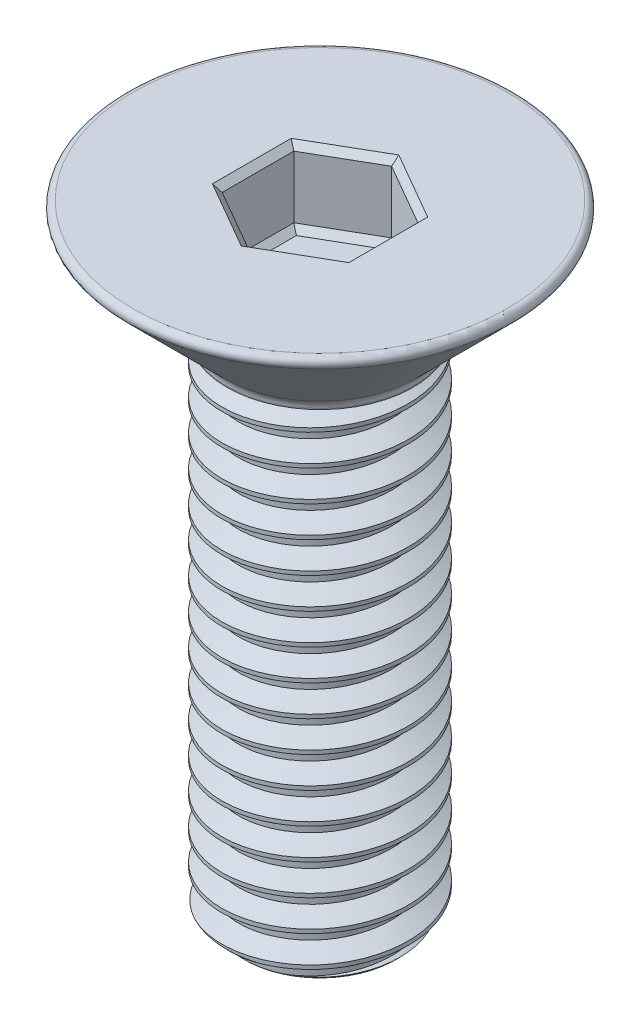
from build123d import *

# Parameters (mm, degrees)
SKETCH1_R           = 1.5
BOSS_EXTRUDE1_DEPTH = 8.14
THREAD1_PITCH       = 0.5
SKETCH5_R           = 1.5
BOSS_EXTRUDE2_DEPTH = 0.1
SKETCH6_R           = 1.5
BOSS_EXTRUDE3_DEPTH = 1.76
BOSS_EXTRUDE3_DRAFT = -45
FILLET1_R           = 0.1
FILLET2_R           = 0.2
CUT_EXTRUDE1_DEPTH  = 1.1
CHAMFER1_SIZE       = 0.1
CUT_EXTRUDE2_DEPTH  = 0.1
CUT_EXTRUDE2_DRAFT  = -45


with BuildPart() as part:
    # Sketch1 → Boss-Extrude1 (new body)
    with BuildSketch(Plane(origin=(0, 0, 0), x_dir=(1, 0, 0), z_dir=(0, 1, 0))):
        with Locations(Location((0, 0, 0), (0, 0, 270))):
            Circle(SKETCH1_R)
    extrude(amount=BOSS_EXTRUDE1_DEPTH)

    # Thread1: the profile of Thread Profile1 profile screwed along a right-hand helix of 18.28 turns, 6 arcs to a turn; built about Z, then put on its axis
    thread1_z = Axis((0, 0, 0), (0, 0, 1))
    thread1_corners = [(1.5003, 0, -0.000173205), (1.5003, 0, 0.437673204), (1.229367063, 0, 0.281249999), (1.229367063, 0, 0.156249999)]
    with BuildLine(mode=Mode.PRIVATE) as thread1_profile:
        Line(thread1_corners[0], thread1_corners[1])
        Line(thread1_corners[1], thread1_corners[2])
        Line(thread1_corners[2], thread1_corners[3])
        Line(thread1_corners[3], thread1_corners[0])
    thread1_cap = Face(thread1_profile.wire())
    thread1_turn_angles = [0, 30, 60, 90, 120, 150, 180, 210, 240, 270, 300, 330, 360]
    thread1_turn_weights = [1, 0.8660254037844387, 1, 0.8660254037844387, 1, 0.8660254037844387, 1, 0.8660254037844387, 1, 0.8660254037844387, 1, 0.8660254037844387, 1]
    thread1_turn_rails = [Edge.make_bspline([Vector(p[0], p[1], 0).rotate(thread1_z, thread1_turn_angles[k]) / thread1_turn_weights[k] + Vector(0, 0, p[2] + THREAD1_PITCH * thread1_turn_angles[k] / 360) for k in range(13)], [0, 0, 0, 1, 1, 2, 2, 3, 3, 4, 4, 5, 5, 6, 6, 6], 2, thread1_turn_weights) for p in thread1_corners]
    thread1_turn_sides = [Face.make_surface_from_curves(thread1_turn_rails[p[0]], thread1_turn_rails[p[1]]) for p in [(0, 1), (1, 2), (2, 3), (3, 0)]]
    thread1_last_angles = [6480, 6510, 6540, 6560.4, 6580.8]
    thread1_last_weights = [1, 0.8660254037844387, 1, 0.9372819894918855, 1]
    thread1_last_rails = [Edge.make_bspline([Vector(p[0], p[1], 0).rotate(thread1_z, thread1_last_angles[k]) / thread1_last_weights[k] + Vector(0, 0, p[2] + THREAD1_PITCH * thread1_last_angles[k] / 360) for k in range(5)], [0, 0, 0, 1, 1, 2, 2, 2], 2, thread1_last_weights) for p in thread1_corners]
    thread1_last_sides = [Face.make_surface_from_curves(thread1_last_rails[p[0]], thread1_last_rails[p[1]]) for p in [(0, 1), (1, 2), (2, 3), (3, 0)]]
    thread1 = Plane(origin=(0, 9.14, 0), x_dir=(-1, 0, 0), z_dir=(0, -1, 0)) * Solid(Shell([*[p.moved(Location((0, 0, THREAD1_PITCH * i))) for i in range(18) for p in thread1_turn_sides], *thread1_last_sides, thread1_cap, thread1_cap.rotate(thread1_z, 6580.8).moved(Location((0, 0, THREAD1_PITCH * 6580.8 / 360)))]))
    add(thread1, mode=Mode.SUBTRACT)

    # Sketch5 → Boss-Extrude2 (add)
    with BuildSketch(Plane(origin=(0, 8.14, 0), x_dir=(1, 0, 0), z_dir=(0, 1, 0))):
        with Locations(Location((0, 0, 0), (0, 0, 79.630240194))):
            Circle(SKETCH5_R)
    extrude(amount=BOSS_EXTRUDE2_DEPTH)


with BuildPart() as boss_extrude3_tool:
    # Sketch6 → Boss-Extrude3 (with draft: the straight prism first)
    with BuildSketch(Plane(origin=(0, 8.24, 0), x_dir=(1, 0, 0), z_dir=(0, 1, 0))):
        with Locations(Location((0, 0, 0), (0, 0, 79.630240194))):
            Circle(SKETCH6_R)
    extrude(amount=BOSS_EXTRUDE3_DEPTH)
    # Boss-Extrude3: the draft: its side faces are tilted about the plane it starts from
    boss_extrude3_sides = [boss_extrude3_tool.faces().sort_by_distance(p)[0] for p in [
        (-0.27, 9.12, 1.475499915),
    ]]
    draft(boss_extrude3_sides, Plane(origin=(0, 8.24, 0), x_dir=(1, 0, 0), z_dir=(0, 1, 0)), BOSS_EXTRUDE3_DRAFT)


with BuildPart() as part_1:
    add(part.part)

    # Boss-Extrude3: add boss_extrude3_tool
    add(boss_extrude3_tool.part)

    # Sketch7 → Cut-Revolve1 (revolve, cut)
    with BuildSketch(Plane.XY, mode=Mode.PRIVATE) as cut_revolve1_sk:
        Polygon((1.51, 0), (1.51, 0.3), (1.21, 0), align=None)
    revolve(cut_revolve1_sk.sketch.rotate(Axis((0, 0, 0), (0, 1, 0)), 135.522486844), axis=Axis((0, 0, 0), (0, 1, 0)), mode=Mode.SUBTRACT)

    # Fillet1
    fillet1_edges = [part_1.edges().sort_by_distance(p)[0] for p in [
        (-0.5868, 10, 3.206753149),
    ]]
    fillet(fillet1_edges, radius=FILLET1_R)

    # Fillet2
    fillet2_edges = [part_1.edges().sort_by_distance(p)[0] for p in [
        (-0.27, 8.24, 1.475499915),
    ]]
    fillet(fillet2_edges, radius=FILLET2_R)

    # Sketch8 → Cut-Extrude1 (cut)
    with BuildSketch(Plane(origin=(0, 10, 0), x_dir=(1, 0, 0), z_dir=(0, 1, 0))):
        Polygon((0, 1.154700538), (-1, 0.577350269), (-1, -0.577350269), (0, -1.154700538), (1, -0.577350269), (1, 0.577350269), align=None)
    extrude(amount=-CUT_EXTRUDE1_DEPTH, mode=Mode.SUBTRACT)

    # Chamfer1
    chamfer1_edges = [part_1.edges().sort_by_distance(p)[0] for p in [
        (0.5, 10, -0.866025404),
        (-0.5, 10, -0.866025404),
        (-1, 10, 0),
        (-0.5, 10, 0.866025404),
        (0.5, 10, 0.866025404),
        (1, 10, 0),
    ]]
    chamfer(chamfer1_edges, length=CHAMFER1_SIZE)


with BuildPart() as cut_extrude2_tool:
    # Sketch9 → Cut-Extrude2 (with draft: the straight prism first)
    with BuildSketch(Plane(origin=(0, 8.9, 0), x_dir=(1, 0, 0), z_dir=(0, 1, 0))):
        Polygon((0, 1.154700538), (-1, 0.577350269), (-1, -0.577350269), (0, -1.154700538), (1, -0.577350269), (1, 0.577350269), align=None)
    extrude(amount=-CUT_EXTRUDE2_DEPTH)
    # Cut-Extrude2: the draft: its side faces are tilted about the plane it starts from
    cut_extrude2_sides = [cut_extrude2_tool.faces().sort_by_distance(p)[0] for p in [
        (-0.5, 8.85, -0.866025404),
        (-1, 8.85, 0),
        (-0.5, 8.85, 0.866025404),
        (0.5, 8.85, 0.866025404),
        (1, 8.85, 0),
        (0.5, 8.85, -0.866025404),
    ]]
    draft(cut_extrude2_sides, Plane(origin=(0, 8.9, 0), x_dir=(1, 0, 0), z_dir=(0, 1, 0)), CUT_EXTRUDE2_DRAFT)


with BuildPart() as part_2:
    add(part_1.part)

    # Cut-Extrude2: cut by cut_extrude2_tool
    add(cut_extrude2_tool.part, mode=Mode.SUBTRACT)


solid = part_2.part
